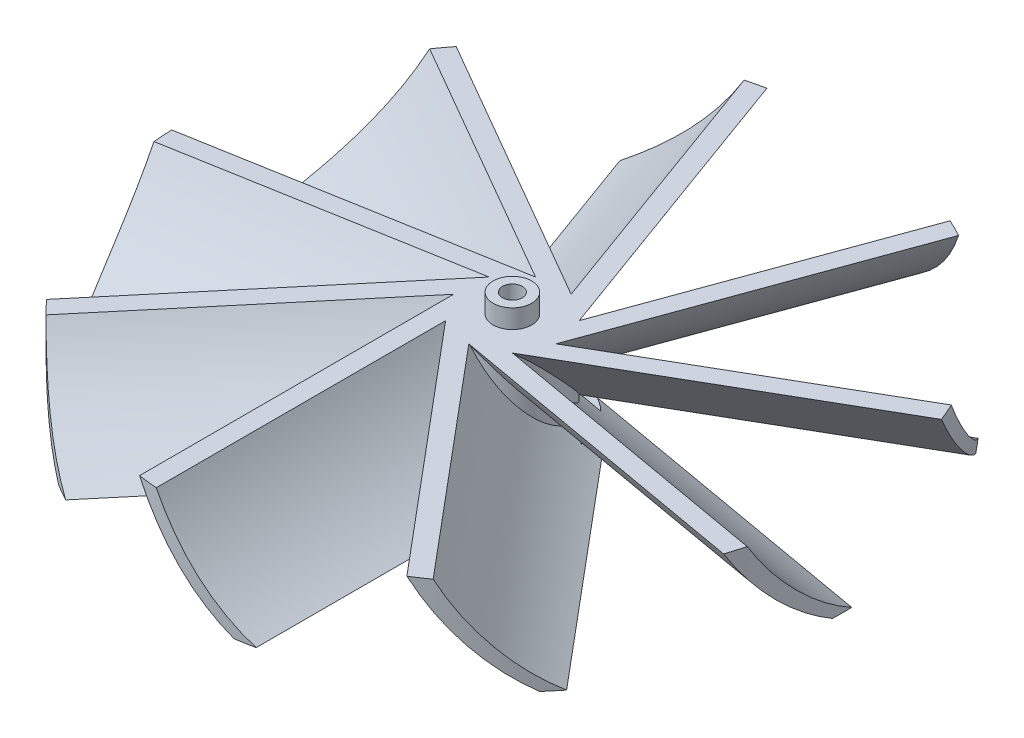
from build123d import *

# Parameters (mm, degrees)
BOSS_EXTRUDE1_DEPTH      = 5
BOSS_EXTRUDE1_DEPTH_BACK = 5
SKETCH1_R                = 5
BOSS_EXTRUDE2_DEPTH      = 45
CIRPATTERN1_COUNT        = 9
SKETCH4_R                = 135
SKETCH4_R_2              = 35
CUT_EXTRUDE1_DEPTH       = 45
CUT_EXTRUDE2_DEPTH       = 5
SKETCH6_R                = 6.634774001
SKETCH6_R_2              = 5
BOSS_EXTRUDE3_DEPTH      = 1
SKETCH7_R                = 2.05
SKETCH7_R_2              = 1.05
BOSS_EXTRUDE4_DEPTH      = 2
CUT_EXTRUDE3_START       = -2
SKETCH8_R                = 1.05
CUT_EXTRUDE3_DEPTH       = 2


with BuildPart() as part:
    # Sketch1 → Boss-Extrude1 (new, two sides: drawn at the far end of the back side and taken through both)
    with BuildSketch(Plane(origin=(0, 0, 0), x_dir=(1, 0, 0), z_dir=(0, 1, 0)).offset(-BOSS_EXTRUDE1_DEPTH_BACK)):
        Circle(SKETCH1_R)
    extrude(amount=BOSS_EXTRUDE1_DEPTH + BOSS_EXTRUDE1_DEPTH_BACK)

    # Sketch2 → Boss-Extrude2 (add)
    with BuildSketch(Plane.XY):
        with BuildLine():
            Line((-4.917468245, 5), (-2.917468245, 5))
            ThreePointArc((-2.917468245, 5), (1.424269267, -0.658262488), (7.082531755, -5))
            Line((7.082531755, -5), (5.082531755, -5))
            ThreePointArc((5.082531755, -5), (-0.575730733, -0.658262488), (-4.917468245, 5))
        make_face()
    boss_extrude2 = extrude(amount=BOSS_EXTRUDE2_DEPTH)

    # CirPattern1: Boss-Extrude2 ×9 about axis
    cirpattern1_axis = Axis((0, 0, 0), (0, 1, 0))
    for i in range(1, CIRPATTERN1_COUNT):
        add(boss_extrude2.rotate(cirpattern1_axis, i * 360 / CIRPATTERN1_COUNT))

    # Sketch4 → Cut-Extrude1 (cut)
    with BuildSketch(Plane(origin=(0, 5, 0), x_dir=(1, 0, 0), z_dir=(0, 1, 0))):
        Circle(SKETCH4_R)
        Circle(SKETCH4_R_2, mode=Mode.SUBTRACT)
    extrude(amount=-CUT_EXTRUDE1_DEPTH, mode=Mode.SUBTRACT)

    # Sketch5 → Cut-Extrude2 (cut)
    with BuildSketch(Plane.XZ.offset(5)):
        with BuildLine():
            Line((-0.625, -0.994987437), (-0.625, 0.994987437))
            ThreePointArc((-0.625, 0.994987437), (1.175, 0), (-0.625, -0.994987437))
        make_face()
    extrude(amount=-CUT_EXTRUDE2_DEPTH, mode=Mode.SUBTRACT)

    # Sketch6 → Boss-Extrude3 (add)
    with BuildSketch(Plane.XZ.offset(5)):
        Circle(SKETCH6_R)
        Circle(SKETCH6_R_2, mode=Mode.SUBTRACT)
    extrude(amount=-BOSS_EXTRUDE3_DEPTH)

    # Sketch7 → Boss-Extrude4 (add)
    with BuildSketch(Plane(origin=(0, 5, 0), x_dir=(1, 0, 0), z_dir=(0, 1, 0))):
        Circle(SKETCH7_R)
        Circle(SKETCH7_R_2, mode=Mode.SUBTRACT)
    extrude(amount=BOSS_EXTRUDE4_DEPTH)

    # Sketch8 → Cut-Extrude3 (cut)
    with BuildSketch(Plane(origin=(0, 5, 0), x_dir=(1, 0, 0), z_dir=(0, 1, 0)).offset(CUT_EXTRUDE3_START)):
        Circle(SKETCH8_R)
    extrude(amount=CUT_EXTRUDE3_DEPTH, mode=Mode.SUBTRACT)


solid = part.part
